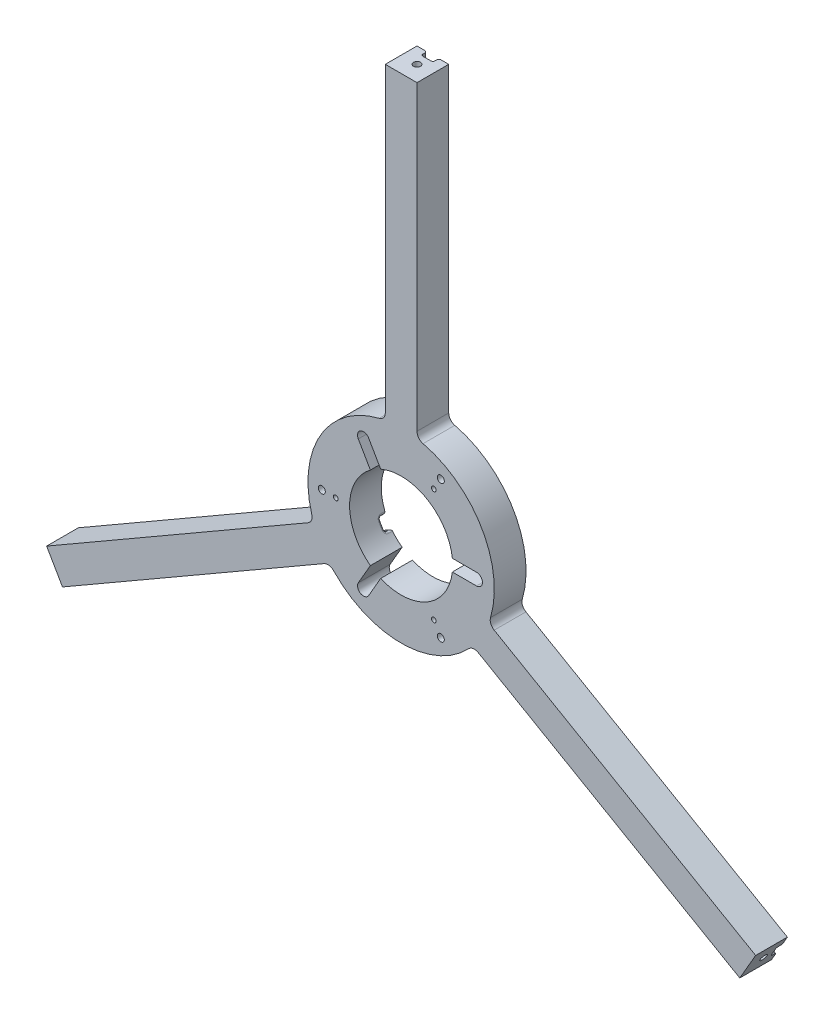
from build123d import *

# Parameters (mm, degrees)
BOSS_EXTRUDE1_DEPTH           = 8
CUT_EXTRUDE1_DEPTH            = 10
CUT_EXTRUDE2_DEPTH            = 10
CIRPATTERN1_COUNT             = 3
CUT_EXTRUDE4_DEPTH            = 1.5
FILLET3_R                     = 0.5
CUT_EXTRUDE5_START            = -8
CUT_EXTRUDE5_DEPTH            = 8
TAP_DRILL_FOR_0_80_TAP1_D     = 1.19126
TAP_DRILL_FOR_0_80_TAP1_DEPTH = 5
TAP_DRILL_FOR_0_80_TAP1_TIP   = 0.357890611
TAP_DRILL_FOR_2_56_TAP1_D     = 1.778
SKETCH17_R                    = 1.5
CUT_EXTRUDE7_DEPTH            = 10
TAP_DRILL_FOR_0_80_TAP2_D     = 1.19126
TAP_DRILL_FOR_0_80_TAP2_DEPTH = 5
TAP_DRILL_FOR_0_80_TAP2_TIP   = 0.357890611
CIRPATTERN2_COUNT             = 3


# Read off the part's stored shape, not the designer's step: Cut-Extrude5
with BuildPart() as part:
    # Sketch1 → Boss-Extrude1 (new body)
    with BuildSketch(Plane.XY):
        with BuildLine():
            ThreePointArc((13.170534883, 107.143546287), (0, 107.95), (-13.170534883, 107.143546287))
            Line((-13.170534883, 107.143546287), (-9.577350269, 100.919967974))
            ThreePointArc((-9.577350269, 100.919967974), (-8.845299462, 100.187917167), (-7.845299462, 99.919967974))
            Line((-7.845299462, 99.919967974), (-6, 99.919967974))
            ThreePointArc((-6, 99.919967974), (-4.585786438, 99.334181537), (-4, 97.919967974))
            Line((-4, 97.919967974), (-4, 24.784067463))
            ThreePointArc((-4, 24.784067463), (-4.428189504, 23.547373578), (-5.529411765, 22.840219034))
            ThreePointArc((-5.529411765, 22.840219034), (-20.351596989, 11.75), (-22.544915794, -6.631498461))
            ThreePointArc((-22.544915794, -6.631498461), (-22.606718463, -7.938762186), (-23.463632032, -8.927932116))
            Line((-23.463632032, -8.927932116), (-86.801179804, -45.495882372))
            ThreePointArc((-86.801179804, -45.495882372), (-88.318817894, -45.695683217), (-89.533230611, -44.763831564))
            Line((-89.533230611, -44.763831564), (-90.455880342, -43.165755353))
            ThreePointArc((-90.455880342, -43.165755353), (-91.18793115, -42.433704546), (-92.18793115, -42.165755353))
            Line((-92.18793115, -42.165755353), (-99.374300377, -42.165755353))
            ThreePointArc((-99.374300377, -42.165755353), (-93.487442339, -53.975), (-86.203765494, -64.977790934))
            Line((-86.203765494, -64.977790934), (-82.61058088, -58.754212621))
            ThreePointArc((-82.61058088, -58.754212621), (-82.342631688, -57.754212621), (-82.61058088, -56.754212621))
            Line((-82.61058088, -56.754212621), (-83.533230611, -55.15613641))
            ThreePointArc((-83.533230611, -55.15613641), (-83.733031456, -53.63849832), (-82.801179804, -52.424085602))
            Line((-82.801179804, -52.424085602), (-19.463632032, -15.856135347))
            ThreePointArc((-19.463632032, -15.856135347), (-18.178528959, -15.608611392), (-17.015504029, -16.208720573))
            ThreePointArc((-17.015504029, -16.208720573), (0, -23.5), (17.015504029, -16.208720573))
            ThreePointArc((17.015504029, -16.208720573), (18.178528959, -15.608611392), (19.463632032, -15.856135347))
            Line((19.463632032, -15.856135347), (82.801179804, -52.424085602))
            ThreePointArc((82.801179804, -52.424085602), (83.733031456, -53.63849832), (83.533230611, -55.15613641))
            Line((83.533230611, -55.15613641), (82.61058088, -56.754212621))
            ThreePointArc((82.61058088, -56.754212621), (82.342631688, -57.754212621), (82.61058088, -58.754212621))
            Line((82.61058088, -58.754212621), (86.203765494, -64.977790934))
            ThreePointArc((86.203765494, -64.977790934), (93.487442339, -53.975), (99.374300377, -42.165755353))
            Line((99.374300377, -42.165755353), (92.18793115, -42.165755353))
            ThreePointArc((92.18793115, -42.165755353), (91.18793115, -42.433704546), (90.455880342, -43.165755353))
            Line((90.455880342, -43.165755353), (89.533230611, -44.763831564))
            ThreePointArc((89.533230611, -44.763831564), (88.318817894, -45.695683217), (86.801179804, -45.495882372))
            Line((86.801179804, -45.495882372), (23.463632032, -8.927932116))
            ThreePointArc((23.463632032, -8.927932116), (22.606718463, -7.938762186), (22.544915794, -6.631498461))
            ThreePointArc((22.544915794, -6.631498461), (20.351596989, 11.75), (5.529411765, 22.840219034))
            ThreePointArc((5.529411765, 22.840219034), (4.428189504, 23.547373578), (4, 24.784067463))
            Line((4, 24.784067463), (4, 97.919967974))
            ThreePointArc((4, 97.919967974), (4.585786438, 99.334181537), (6, 99.919967974))
            Line((6, 99.919967974), (7.845299462, 99.919967974))
            ThreePointArc((7.845299462, 99.919967974), (8.845299462, 100.187917167), (9.577350269, 100.919967974))
            Line((9.577350269, 100.919967974), (13.170534883, 107.143546287))
        make_face()
        with BuildLine():
            ThreePointArc((4, 12.369316877), (0, -13), (-4, 12.369316877))
            ThreePointArc((-4, 12.369316877), (0, 13), (4, 12.369316877))
        make_face(mode=Mode.SUBTRACT)
    extrude(amount=BOSS_EXTRUDE1_DEPTH)

    # Sketch2 → Cut-Extrude1 (cut)
    with BuildSketch(Plane(origin=(9.40846243, 107.539217659, 0), x_dir=(-0.9961946980917455, 0.08715574274765836, 0), z_dir=(0.08715574274765836, 0.9961946980917455, 0))):
        with BuildLine():
            ThreePointArc((-0.306241664, 4), (1.217758336, 2.476), (2.741758336, 4))
            Line((2.741758336, 4), (-0.306241664, 4))
        make_face()
        with BuildLine():
            Line((-0.306241664, 4), (2.741758336, 4))
            ThreePointArc((2.741758336, 4), (1.217758336, 5.524), (-0.306241664, 4))
        make_face()
    cut_extrude1 = extrude(amount=-CUT_EXTRUDE1_DEPTH, mode=Mode.SUBTRACT)

    # Sketch3 → Cut-Extrude2 (cut)
    with BuildSketch(Plane(origin=(-9.40846243, 107.539217659, 0), x_dir=(-0.9961946980917455, -0.08715574274765839, 0), z_dir=(-0.08715574274765839, 0.9961946980917455, 0))):
        with BuildLine():
            ThreePointArc((-2.741758336, 4), (-1.217758336, 2.476), (0.306241664, 4))
            Line((0.306241664, 4), (-2.741758336, 4))
        make_face()
        with BuildLine():
            Line((-2.741758336, 4), (0.306241664, 4))
            ThreePointArc((0.306241664, 4), (-1.217758336, 5.524), (-2.741758336, 4))
        make_face()
    cut_extrude2 = extrude(amount=-CUT_EXTRUDE2_DEPTH, mode=Mode.SUBTRACT)

    # CirPattern1: Cut-Extrude1, Cut-Extrude2 ×3 about axis
    cirpattern1_axis = Axis((0, 0, 8), (0, 0, -1))
    add([cut_extrude1.rotate(cirpattern1_axis, i * 360 / CIRPATTERN1_COUNT) for i in range(1, CIRPATTERN1_COUNT)], mode=Mode.SUBTRACT)
    add([cut_extrude2.rotate(cirpattern1_axis, i * 360 / CIRPATTERN1_COUNT) for i in range(1, CIRPATTERN1_COUNT)], mode=Mode.SUBTRACT)

    # Sketch7 → Cut-Extrude4 (cut)
    with BuildSketch(Plane(origin=(0, 0, 0), x_dir=(-1, 0, 0), z_dir=(0, 0, -1))):
        with BuildLine():
            ThreePointArc((-1.5, 12.91317157), (0, 13), (1.5, 12.91317157))
            Line((1.5, 12.91317157), (1.5, 107.939578005))
            ThreePointArc((1.5, 107.939578005), (0, 107.95), (-1.5, 107.939578005))
            Line((-1.5, 107.939578005), (-1.5, 12.91317157))
        make_face()
        with BuildLine():
            Line((94.228416627, -52.670750897), (11.933134623, -5.157547679))
            ThreePointArc((11.933134623, -5.157547679), (11.258330249, -6.5), (10.433134623, -7.755623891))
            Line((10.433134623, -7.755623891), (92.728416627, -55.268827108))
            ThreePointArc((92.728416627, -55.268827108), (93.487442339, -53.975), (94.228416627, -52.670750897))
        make_face()
        with BuildLine():
            ThreePointArc((-10.433134623, -7.755623891), (-11.258330249, -6.5), (-11.933134623, -5.157547679))
            Line((-11.933134623, -5.157547679), (-94.228416627, -52.670750897))
            ThreePointArc((-94.228416627, -52.670750897), (-93.487442339, -53.975), (-92.728416627, -55.268827108))
            Line((-92.728416627, -55.268827108), (-10.433134623, -7.755623891))
        make_face()
    extrude(amount=-CUT_EXTRUDE4_DEPTH, mode=Mode.SUBTRACT)

    # Fillet3
    fillet3_edges = [part.edges().sort_by_distance(p)[0] for p in [
        (53.080775625, -28.914149288, 0),
        (51.580775625, -31.5122255, 0),
        (-51.580775625, -31.5122255, 0),
        (-53.080775625, -28.914149288, 0),
        (-1.5, 60.426374788, 0),
        (1.5, 60.426374788, 0),
        (-11.258330249, -6.5, 1.5),
        (11.258330249, -6.5, 1.5),
        (0, 13, 1.5),
        (1.5, 60.426374788, 1.5),
        (51.580775625, -31.5122255, 1.5),
        (-1.5, 12.91317157, 0.75),
        (-10.433134623, -7.755623891, 0.75),
        (11.933134623, -5.157547679, 0.75),
        (1.5, 12.91317157, 0.75),
        (0, 107.95, 1.5),
        (1.5, 107.939578005, 0.75),
        (-1.5, 60.426374788, 1.5),
        (-1.5, 107.939578005, 0.75),
        (-11.933134623, -5.157547679, 0.75),
        (-93.487442339, -53.975, 1.5),
        (-94.228416627, -52.670750897, 0.75),
        (-51.580775625, -31.5122255, 1.5),
        (-92.728416627, -55.268827108, 0.75),
        (10.433134623, -7.755623891, 0.75),
        (93.487442339, -53.975, 1.5),
        (92.728416627, -55.268827108, 0.75),
        (53.080775625, -28.914149288, 1.5),
        (94.228416627, -52.670750897, 0.75),
        (-53.080775625, -28.914149288, 1.5),
    ]]
    fillet(fillet3_edges, radius=FILLET3_R)

    # Cut-Extrude5 outline → Cut-Extrude5 (cut)
    with BuildSketch(Plane.XY.offset(8).offset(CUT_EXTRUDE5_START)):
        with BuildLine():
            Line((86.801179804, -45.495882372), (89.399256015, -46.995882372))
            Line((89.399256015, -46.995882372), (85.399256015, -53.924085602))
            Line((85.399256015, -53.924085602), (82.801179804, -52.424085602))
            ThreePointArc((82.801179804, -52.424085602), (83.73303184, -53.638499754), (83.533229126, -55.156138981))
            Line((83.533229126, -55.156138981), (82.610581298, -56.754211898))
            ThreePointArc((82.610581298, -56.754211898), (82.342631688, -57.754212203), (82.61058088, -58.754212621))
            Line((82.61058088, -58.754212621), (86.203765494, -64.977790934))
            ThreePointArc((86.203765494, -64.977790934), (93.487442339, -53.975), (99.374300377, -42.165755353))
            Line((99.374300377, -42.165755353), (92.18793115, -42.165755353))
            ThreePointArc((92.18793115, -42.165755353), (91.187931068, -42.433704593), (90.455880247, -43.165755517))
            Line((90.455880247, -43.165755517), (89.533232096, -44.763828993))
            ThreePointArc((89.533232096, -44.763828993), (88.318819328, -45.695682833), (86.801179804, -45.495882372))
        make_face()
        with BuildLine():
            Line((-82.801179804, -52.424085602), (-85.399256015, -53.924085602))
            Line((-85.399256015, -53.924085602), (-89.399256015, -46.995882372))
            Line((-89.399256015, -46.995882372), (-86.801179804, -45.495882372))
            ThreePointArc((-86.801179804, -45.495882372), (-88.318819328, -45.695682833), (-89.533232096, -44.763828993))
            Line((-89.533232096, -44.763828993), (-90.455880258, -43.165755498))
            ThreePointArc((-90.455880258, -43.165755498), (-91.187931077, -42.433704587), (-92.18793115, -42.165755353))
            Line((-92.18793115, -42.165755353), (-99.374300377, -42.165755353))
            ThreePointArc((-99.374300377, -42.165755353), (-93.487442339, -53.975), (-86.203765494, -64.977790934))
            Line((-86.203765494, -64.977790934), (-82.61058088, -58.754212621))
            ThreePointArc((-82.61058088, -58.754212621), (-82.342631688, -57.754212527), (-82.610580974, -56.754212458))
            Line((-82.610580974, -56.754212458), (-83.533229126, -55.156138981))
            ThreePointArc((-83.533229126, -55.156138981), (-83.73303184, -53.638499754), (-82.801179804, -52.424085602))
        make_face()
        with BuildLine():
            Line((-4, 97.919967974), (-4, 100.919967974))
            Line((-4, 100.919967974), (4, 100.919967974))
            Line((4, 100.919967974), (4, 97.919967974))
            ThreePointArc((4, 97.919967974), (4.585786437, 99.334181536), (6, 99.919967974))
            Line((6, 99.919967974), (7.845299462, 99.919967974))
            ThreePointArc((7.845299462, 99.919967974), (8.845299462, 100.187917167), (9.577350269, 100.919967974))
            Line((9.577350269, 100.919967974), (13.170534883, 107.143546287))
            ThreePointArc((13.170534883, 107.143546287), (0, 107.95), (-13.170534883, 107.143546287))
            Line((-13.170534883, 107.143546287), (-9.577350269, 100.919967974))
            ThreePointArc((-9.577350269, 100.919967974), (-8.845299462, 100.187917167), (-7.845299462, 99.919967974))
            Line((-7.845299462, 99.919967974), (-6, 99.919967974))
            ThreePointArc((-6, 99.919967974), (-4.585786437, 99.334181537), (-4, 97.919967974))
        make_face()
    extrude(amount=CUT_EXTRUDE5_DEPTH, mode=Mode.SUBTRACT)

    # Tap Drill for #0-80 Tap1
    with Locations(Plane(origin=(8.25, 14.289419162, 8), x_dir=(1, 0, 0), z_dir=(0, 0, 1))):
        with Locations((0, 0), (0, -28.578838324), (-24.75, -14.289419162)):
            Hole(TAP_DRILL_FOR_0_80_TAP1_D / 2, depth=TAP_DRILL_FOR_0_80_TAP1_DEPTH)
            with Locations((0, 0, -(TAP_DRILL_FOR_0_80_TAP1_DEPTH + TAP_DRILL_FOR_0_80_TAP1_TIP / 2))):  # 118° drill point
                Cone(0, TAP_DRILL_FOR_0_80_TAP1_D / 2, TAP_DRILL_FOR_0_80_TAP1_TIP, mode=Mode.SUBTRACT)

    # Tap Drill for #2-56 Tap1 (through all)
    with Locations(Plane(origin=(10, 17.320508076, 0), x_dir=(-1, 0, 0), z_dir=(0, 0, -1))):
        with Locations((0, 0), (30, -17.320508076), (0, -34.641016152)):
            Hole(TAP_DRILL_FOR_2_56_TAP1_D / 2)

    # Sketch17 → Cut-Extrude7 (cut)
    with BuildSketch(Plane(origin=(0, 0, 0), x_dir=(-1, 0, 0), z_dir=(0, 0, -1))):
        with Locations((-19, 0)):
            Circle(SKETCH17_R)
        with BuildLine():
            ThreePointArc((-9.614616943, -1.5), (-9.730922821, 0), (-9.614616943, 1.5))
            Line((-9.614616943, 1.5), (-19, 1.5))
            ThreePointArc((-19, 1.5), (-17.939339828, 1.060660172), (-17.5, 0))
            ThreePointArc((-17.5, 0), (-17.939339828, -1.060660172), (-19, -1.5))
            Line((-19, -1.5), (-9.614616943, -1.5))
        make_face()
        with Locations((9.5, 16.454482672)):
            Circle(SKETCH17_R)
        with BuildLine():
            ThreePointArc((5.157547679, 11.933134623), (6.5, 11.258330249), (7.755623891, 10.433134623))
            Line((7.755623891, 10.433134623), (10.799038104, 15.704482669))
            ThreePointArc((10.799038104, 15.704482669), (8.749999997, 15.155444568), (8.200961896, 17.204482674))
            Line((8.200961896, 17.204482674), (5.157547679, 11.933134623))
        make_face()
        with Locations((9.5, -16.454482672)):
            Circle(SKETCH17_R)
        with BuildLine():
            Line((10.799037843, -15.704482216), (6.106346577, -7.57650252))
            ThreePointArc((6.106346577, -7.57650252), (4.865461411, -8.427226366), (3.508270366, -9.07650252))
            Line((3.508270366, -9.07650252), (8.200961877, -17.204482641))
            ThreePointArc((8.200961877, -17.204482641), (8.749999787, -15.155444689), (10.799037843, -15.704482216))
        make_face()
        with BuildLine():
            ThreePointArc((3.508270366, 9.07650252), (4.865461411, 8.427226366), (6.106346577, 7.57650252))
            Line((6.106346577, 7.57650252), (7.755623891, 10.433134623))
            ThreePointArc((7.755623891, 10.433134623), (6.5, 11.258330249), (5.157547679, 11.933134623))
            Line((5.157547679, 11.933134623), (3.508270366, 9.07650252))
        make_face()
    extrude(amount=-CUT_EXTRUDE7_DEPTH, mode=Mode.SUBTRACT)

    # Tap Drill for #0-80 Tap2
    with Locations(Plane(origin=(12.990381057, 7.5, 0), x_dir=(-1, 0, 0), z_dir=(0, 0, -1))):
        with Locations((0, 0), (25.980762114, 0), (12.990381057, -22.5)):
            Hole(TAP_DRILL_FOR_0_80_TAP2_D / 2, depth=TAP_DRILL_FOR_0_80_TAP2_DEPTH)
            with Locations((0, 0, -(TAP_DRILL_FOR_0_80_TAP2_DEPTH + TAP_DRILL_FOR_0_80_TAP2_TIP / 2))):  # 118° drill point
                Cone(0, TAP_DRILL_FOR_0_80_TAP2_D / 2, TAP_DRILL_FOR_0_80_TAP2_TIP, mode=Mode.SUBTRACT)

    # Sketch21 → Tap Drill for #2-56 Tap2 (revolve, cut)
    with BuildSketch(Plane(origin=(0, 100.919967974, 4), x_dir=(0, 0, 1), z_dir=(1, 0, 0))):
        Polygon((0, 0), (0, 8.53416509), (0.889, 8), (0.889, 0), align=None)
    tap_drill_for_2_56_tap2 = revolve(axis=Axis((0, 107.269967974, 4), (0, -1, 0)), mode=Mode.SUBTRACT)

    # CirPattern2: Tap Drill for #2-56 Tap2 ×3 about axis
    cirpattern2_axis = Axis((0, 0, 8), (0, 0, -1))
    for i in range(1, CIRPATTERN2_COUNT):
        add(tap_drill_for_2_56_tap2.rotate(cirpattern2_axis, i * 360 / CIRPATTERN2_COUNT), mode=Mode.SUBTRACT)


solid = part.part
